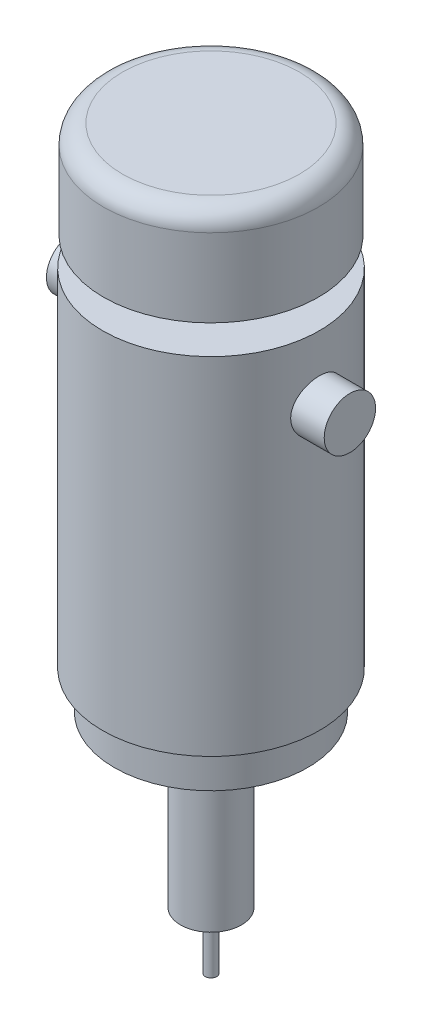
from build123d import *

# Parameters (mm, degrees)
SKETCH1_R           = 28.5
BOSS_EXTRUDE1_DEPTH = 45.5
SKETCH4_R           = 25.4
BOSS_EXTRUDE4_DEPTH = 10
SKETCH5_R           = 12.65
BOSS_EXTRUDE5_DEPTH = 2.5
SKETCH2_R           = 8
BOSS_EXTRUDE2_DEPTH = 42
SKETCH6_R           = 4
BOSS_EXTRUDE6_DEPTH = 33
SKETCH7_R           = 28.25
BOSS_EXTRUDE7_DEPTH = 25.5
FILLET1_R           = 5
SKETCH3_R           = 1.5
BOSS_EXTRUDE3_DEPTH = 15
SKETCH8_R           = 6.75
BOSS_EXTRUDE8_DEPTH = 36.5


with BuildPart() as part:
    # Sketch1 → Boss-Extrude1 (new, symmetric)
    with BuildSketch(Plane(origin=(0, 0, 0), x_dir=(1, 0, 0), z_dir=(0, 1, 0))):
        Circle(SKETCH1_R)
    extrude(amount=BOSS_EXTRUDE1_DEPTH, both=True)

    # Sketch4 → Boss-Extrude4 (add)
    with BuildSketch(Plane.XZ.offset(45.5)):
        Circle(SKETCH4_R)
    extrude(amount=BOSS_EXTRUDE4_DEPTH)

    # Sketch5 → Boss-Extrude5 (add)
    with BuildSketch(Plane.XZ.offset(55.5)):
        Circle(SKETCH5_R)
    extrude(amount=BOSS_EXTRUDE5_DEPTH)

    # Sketch2 → Boss-Extrude2 (add)
    with BuildSketch(Plane.XZ.offset(58)):
        Circle(SKETCH2_R)
    extrude(amount=BOSS_EXTRUDE2_DEPTH)

    # Sketch6 → Boss-Extrude6 (add)
    with BuildSketch(Plane(origin=(0, 45.5, 0), x_dir=(1, 0, 0), z_dir=(0, 1, 0))):
        Circle(SKETCH6_R)
    extrude(amount=BOSS_EXTRUDE6_DEPTH)

    # Sketch7 → Boss-Extrude7 (add)
    with BuildSketch(Plane(origin=(0, 78.5, 0), x_dir=(1, 0, 0), z_dir=(0, 1, 0))):
        Circle(SKETCH7_R)
    extrude(amount=-BOSS_EXTRUDE7_DEPTH)

    # Fillet1
    fillet1_edges = [part.edges().sort_by_distance(p)[0] for p in [
        (-28.25, 78.5, 0),
    ]]
    fillet(fillet1_edges, radius=FILLET1_R)

    # Sketch3 → Boss-Extrude3 (add)
    with BuildSketch(Plane.XZ.offset(100)):
        Circle(SKETCH3_R)
    extrude(amount=BOSS_EXTRUDE3_DEPTH)

    # Sketch8 → Boss-Extrude8 (add, symmetric)
    with BuildSketch(Plane(origin=(0, 0, 0), x_dir=(0, 0, -1), z_dir=(1, 0, 0))):
        with Locations((0, 28.5)):
            Circle(SKETCH8_R)
    extrude(amount=BOSS_EXTRUDE8_DEPTH, both=True)


solid = part.part
